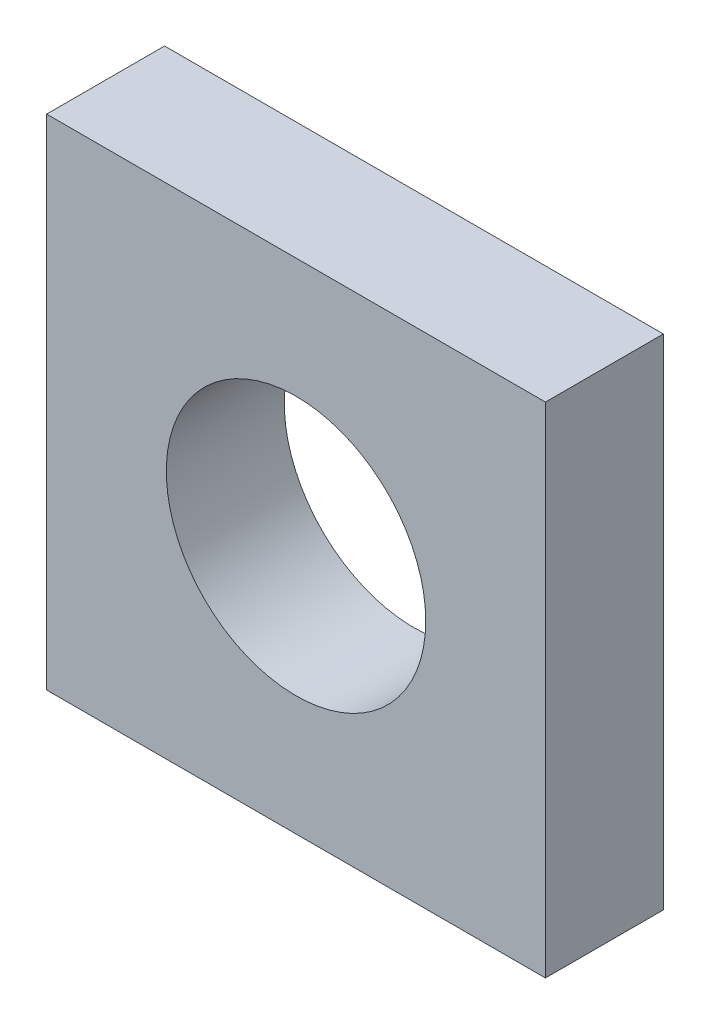
from build123d import *

# Parameters (mm, degrees)
SKETCH1_W           = 42.3
SKETCH1_H           = 42.3
SKETCH1_R           = 11
BOSS_EXTRUDE1_DEPTH = 10


with BuildPart() as part:
    # Sketch1 → Boss-Extrude1 (new body)
    with BuildSketch(Plane.XY):
        Rectangle(SKETCH1_W, SKETCH1_H)
        Circle(SKETCH1_R, mode=Mode.SUBTRACT)
    extrude(amount=BOSS_EXTRUDE1_DEPTH)


solid = part.part
